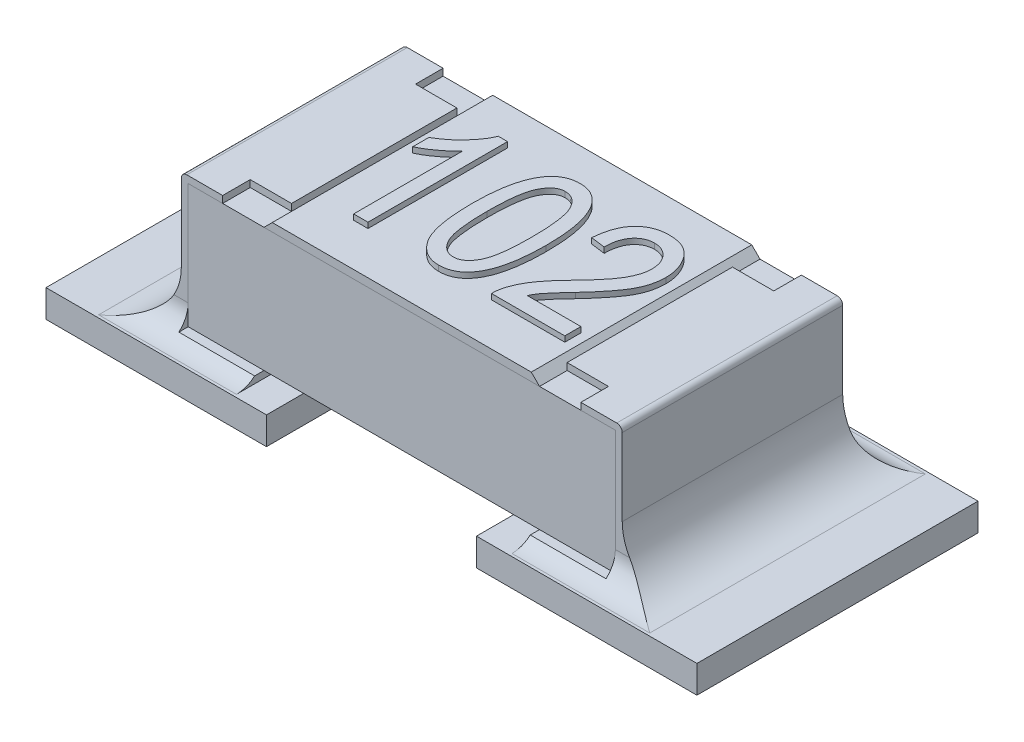
from build123d import *

# Parameters (mm, degrees)
SKETCH1_W             = 0.8
SKETCH1_H             = 0.45
BOSS_EXTRUDE1_DEPTH   = 0.775
BOSS_EXTRUDE2_DEPTH   = 0.4
BOSS_EXTRUDE2_2_DEPTH = 0.4
SKETCH3_W             = 0.15
SKETCH3_H             = 0.1
CUT_EXTRUDE1_DEPTH    = 0.025
BOSS_EXTRUDE3_DEPTH   = 0.4
SKETCH7_W             = 0.8
SKETCH7_H             = 1.02
BOSS_EXTRUDE5_DEPTH   = 0.1
FILLET3_R             = 0.2
FILLET4_R             = 0.2
FILLET5_R             = 0.1
FILLET6_R             = 0.1
BOSS_EXTRU_1_DEPTH    = 0.02


with BuildPart() as part:
    # Sketch1 → Boss-Extrude1 (new, symmetric)
    with BuildSketch(Plane(origin=(0, 0, 0), x_dir=(0, 0, -1), z_dir=(1, 0, 0))):
        with Locations((0, 0.35)):
            Rectangle(SKETCH1_W, SKETCH1_H)
    extrude(amount=BOSS_EXTRUDE1_DEPTH, both=True)


with BuildPart() as body_2:
    # Sketch2 → Boss-Extrude2 (new, symmetric)
    with BuildSketch(Plane.XY):
        with BuildLine():
            Line((-0.5, 0.6), (-0.78, 0.6))
            ThreePointArc((-0.78, 0.6), (-0.794142136, 0.594142136), (-0.8, 0.58))
            Line((-0.8, 0.58), (-0.8, 0.1))
            Line((-0.8, 0.1), (-0.5, 0.1))
            Line((-0.5, 0.1), (-0.5, 0.125))
            Line((-0.5, 0.125), (-0.775, 0.125))
            Line((-0.775, 0.125), (-0.775, 0.575))
            Line((-0.775, 0.575), (-0.5, 0.575))
            Line((-0.5, 0.575), (-0.5, 0.6))
        make_face()
    extrude(amount=BOSS_EXTRUDE2_DEPTH, both=True)


with BuildPart() as body_3:
    # Sketch2 → Boss-Extrude2 2 (new, symmetric)
    with BuildSketch(Plane.XY):
        with BuildLine():
            Line((0.5, 0.575), (0.5, 0.6))
            Line((0.5, 0.6), (0.78, 0.6))
            ThreePointArc((0.78, 0.6), (0.794142136, 0.594142136), (0.8, 0.58))
            Line((0.8, 0.58), (0.8, 0.1))
            Line((0.8, 0.1), (0.5, 0.1))
            Line((0.5, 0.1), (0.5, 0.125))
            Line((0.5, 0.125), (0.775, 0.125))
            Line((0.775, 0.125), (0.775, 0.575))
            Line((0.775, 0.575), (0.5, 0.575))
        make_face()
    extrude(amount=BOSS_EXTRUDE2_2_DEPTH, both=True)


with BuildPart() as cut_extrude1_tool:
    # Sketch3 → Cut-Extrude1 (new body)
    with BuildSketch(Plane(origin=(0, 0.6, 0), x_dir=(1, 0, 0), z_dir=(0, 1, 0))):
        with Locations((-0.575, 0.35)):
            Rectangle(SKETCH3_W, SKETCH3_H)
        with Locations((-0.575, -0.35)):
            Rectangle(SKETCH3_W, SKETCH3_H)
        with Locations((0.575, -0.35)):
            Rectangle(SKETCH3_W, SKETCH3_H)
        with Locations((0.575, 0.35)):
            Rectangle(SKETCH3_W, SKETCH3_H)
    extrude(amount=-CUT_EXTRUDE1_DEPTH)


with BuildPart() as body_2_1:
    add(body_2.part)

    # Cut-Extrude1: cut by cut_extrude1_tool
    add(cut_extrude1_tool.part, mode=Mode.SUBTRACT)



with BuildPart() as body_3_1:
    add(body_3.part)

    # Cut-Extrude1: cut by cut_extrude1_tool
    add(cut_extrude1_tool.part, mode=Mode.SUBTRACT)


with BuildPart() as body_4:
    # Sketch4 → Boss-Extrude3 (new, symmetric)
    with BuildSketch(Plane.XY):
        Polygon((-0.5, 0.575), (0.5, 0.575), (0.47, 0.605), (-0.47, 0.605), align=None)
    extrude(amount=BOSS_EXTRUDE3_DEPTH, both=True)

    # Esquisse2 → Boss.-Extru.1 (add)
    # profile 1 of 3: a face of its own
    with BuildSketch(Plane(origin=(0, 0.605, 0), x_dir=(1, 0, 0), z_dir=(0, 1, 0))):
        with BuildLine():
            Line((-0.277419159, -0.245221888), (-0.329367211, -0.245221888))
            Line((-0.329367211, -0.245221888), (-0.329367211, 0.150882009))
            add(Edge.make_bspline(
                [(-0.329367211, 0.150882009), (-0.33255753, 0.147209677), (-0.339169464, 0.139598774), (-0.350647442, 0.128775009), (-0.363438381, 0.1176135), (-0.377599648, 0.106782892), (-0.392028853, 0.096408923), (-0.406280373, 0.087284837), (-0.41982007, 0.079346193), (-0.428903295, 0.075031174), (-0.433263315, 0.072959931)],
                knots=[0, 0, 0, 0, 0.892555828, 1.849821039, 2.893015883, 4.008277588, 5.121255548, 6.154629642, 7.114207698, 8, 8, 8, 8], degree=3))
            Line((-0.433263315, 0.072959931), (-0.433263315, 0.131401489))
            add(Edge.make_bspline(
                [(-0.433263315, 0.131401489), (-0.426256411, 0.13561851), (-0.412302603, 0.144016443), (-0.392751491, 0.158564375), (-0.374281809, 0.174266475), (-0.35744561, 0.191287267), (-0.342370643, 0.208833156), (-0.329431452, 0.226343975), (-0.318822135, 0.243633673), (-0.313617925, 0.255526991), (-0.311104224, 0.261271619)],
                knots=[0, 0, 0, 0, 1.082272232, 2.155277244, 3.222407096, 4.289527553, 5.32168536, 6.282742408, 7.170542132, 8, 8, 8, 8], degree=3))
            Line((-0.311104224, 0.261271619), (-0.277419159, 0.261271619))
            Line((-0.277419159, 0.261271619), (-0.277419159, -0.245221888))
        make_face()
    # profile 2 of 3: a face of its own
    with BuildSketch(Plane(origin=(0, 0.605, 0), x_dir=(1, 0, 0), z_dir=(0, 1, 0))):
        with BuildLine():
            add(Edge.make_bspline(
                [(-0.147549029, 0.00457519), (-0.147466537, 0.01479126), (-0.147306358, 0.034628409), (-0.145650941, 0.063399949), (-0.143039858, 0.090278959), (-0.139489137, 0.115229398), (-0.134683655, 0.138255011), (-0.12902472, 0.15939274), (-0.122074419, 0.178575365), (-0.114251427, 0.195885139), (-0.105280253, 0.21122541), (-0.095389914, 0.224648892), (-0.084287025, 0.235937722), (-0.072277736, 0.245324824), (-0.059123137, 0.252476152), (-0.04501046, 0.257615666), (-0.029887534, 0.260717058), (-0.019452187, 0.261084261), (-0.014127763, 0.261271619)],
                knots=[0, 0, 0, 0, 1.522295809, 2.955932353, 4.292935845, 5.545987552, 6.709403679, 7.796379217, 8.803980711, 9.746667296, 10.623167879, 11.447716403, 12.224665142, 12.975696349, 13.710987297, 14.4460191, 15.207112772, 16, 16, 16, 16], degree=3))
            add(Edge.make_bspline(
                [(-0.014127763, 0.261271619), (-0.00938285, 0.261119405), (-6.4928e-05, 0.260820492), (0.013532278, 0.258355488), (0.026321328, 0.254161939), (0.038311883, 0.248334155), (0.04946752, 0.240809961), (0.059897997, 0.231712272), (0.069489012, 0.22085766), (0.075042737, 0.212703293), (0.0778974, 0.208511879)],
                knots=[0, 0, 0, 0, 1.02435884, 2.0116063, 2.972586715, 3.92329494, 4.881606269, 5.870473939, 6.905405214, 8, 8, 8, 8], degree=3))
            add(Edge.make_bspline(
                [(0.0778974, 0.208511879), (0.081201753, 0.202860902), (0.088073505, 0.191109101), (0.09627871, 0.171419216), (0.103194942, 0.149427268), (0.109026426, 0.125063264), (0.113186158, 0.098276968), (0.116478331, 0.069172575), (0.118383679, 0.037676929), (0.118581978, 0.015873733), (0.118684737, 0.00457519)],
                knots=[0, 0, 0, 0, 0.745747152, 1.550859881, 2.42529298, 3.372802996, 4.404287875, 5.514077945, 6.711780846, 8, 8, 8, 8], degree=3))
            add(Edge.make_bspline(
                [(0.118684737, 0.00457519), (0.118603246, -0.005573368), (0.118445039, -0.025275587), (0.116773055, -0.053910105), (0.114196761, -0.080658499), (0.110597814, -0.10553284), (0.105836898, -0.128501924), (0.100102772, -0.149633905), (0.093369381, -0.168919426), (0.085438101, -0.186231046), (0.076598991, -0.201660817), (0.066540873, -0.214948272), (0.055705564, -0.226438872), (0.043540388, -0.23562265), (0.030475546, -0.242976397), (0.016267757, -0.248029288), (0.001094421, -0.251174149), (-0.009377101, -0.25153216), (-0.014736529, -0.251715394)],
                knots=[0, 0, 0, 0, 1.513874866, 2.939007974, 4.277477108, 5.521918538, 6.686610019, 7.774777114, 8.786532326, 9.730252297, 10.61206932, 11.433487149, 12.211385775, 12.960169701, 13.698700869, 14.439280195, 15.201208188, 16, 16, 16, 16], degree=3))
            add(Edge.make_bspline(
                [(-0.014736529, -0.251715394), (-0.019516724, -0.251535975), (-0.028915126, -0.251183218), (-0.042705055, -0.248501144), (-0.05575647, -0.243876751), (-0.068138313, -0.237523555), (-0.079867046, -0.229401051), (-0.090799365, -0.219338145), (-0.101199397, -0.207599728), (-0.110942062, -0.19396939), (-0.119746041, -0.178096762), (-0.127188231, -0.159604049), (-0.133528749, -0.138579583), (-0.138560256, -0.114938484), (-0.142795274, -0.08877738), (-0.145456819, -0.059965056), (-0.147220924, -0.028557109), (-0.147436804, -0.006757381), (-0.147549029, 0.00457519)],
                knots=[0, 0, 0, 0, 0.713782411, 1.403376538, 2.088831486, 2.775699897, 3.476400496, 4.213162367, 4.989742879, 5.815463779, 6.710980744, 7.6941898, 8.787315853, 9.987366569, 11.302150399, 12.743876293, 14.307306722, 16, 16, 16, 16], degree=3))
        make_face()
        with BuildLine():
            add(Edge.make_bspline(
                [(-0.095600977, 0.004778112), (-0.095510395, -0.004962844), (-0.095337358, -0.023570963), (-0.094386416, -0.050273881), (-0.092589043, -0.074440086), (-0.090092676, -0.096145725), (-0.086927693, -0.115301137), (-0.083021376, -0.132011786), (-0.078366616, -0.146209724), (-0.072890289, -0.158097103), (-0.066817423, -0.167965156), (-0.060330818, -0.176373903), (-0.053623871, -0.183666527), (-0.046292266, -0.189491854), (-0.038680682, -0.194202042), (-0.030494994, -0.19727545), (-0.022023943, -0.199493814), (-0.016171753, -0.199675523), (-0.013214613, -0.199767342)],
                knots=[0, 0, 0, 0, 1.930873368, 3.688541263, 5.295281011, 6.732986767, 8.018032389, 9.141589856, 10.131594649, 10.974379403, 11.729767228, 12.422984227, 13.077418253, 13.687793181, 14.274134012, 14.843047171, 15.415386244, 16, 16, 16, 16], degree=3))
            add(Edge.make_bspline(
                [(-0.013214613, -0.199767342), (-0.010427064, -0.19967107), (-0.004876608, -0.199479377), (0.003214206, -0.197283662), (0.011014124, -0.194062792), (0.018392056, -0.189401372), (0.025337409, -0.183405877), (0.031944313, -0.176126804), (0.038222607, -0.167556151), (0.044243115, -0.157540122), (0.049661257, -0.145592351), (0.054269802, -0.131326946), (0.058147641, -0.114621658), (0.061355308, -0.095476215), (0.063679163, -0.073856395), (0.065539644, -0.049836144), (0.066465897, -0.023333722), (0.066643834, -0.004861208), (0.066736685, 0.004778112)],
                knots=[0, 0, 0, 0, 0.556098029, 1.107279675, 1.665020537, 2.239289732, 2.843790749, 3.494855459, 4.20099618, 4.965402842, 5.827994078, 6.818278647, 7.958442113, 9.254955883, 10.697998423, 12.305588537, 14.072183745, 16, 16, 16, 16], degree=3))
            add(Edge.make_bspline(
                [(0.066736685, 0.004778112), (0.066644247, 0.014518953), (0.066467022, 0.033194439), (0.065536544, 0.059932684), (0.063706558, 0.084163121), (0.061254358, 0.105841815), (0.058028708, 0.125018143), (0.054199757, 0.141717126), (0.049468888, 0.155886496), (0.044070333, 0.167750164), (0.037873861, 0.177530431), (0.031547138, 0.186066808), (0.024613966, 0.193179002), (0.017326453, 0.199101273), (0.009578464, 0.203716122), (0.001336, 0.207013805), (-0.007336855, 0.208998194), (-0.013272092, 0.209214654), (-0.016258444, 0.209323567)],
                knots=[0, 0, 0, 0, 1.926173374, 3.692928135, 5.28908838, 6.72993665, 8.005261178, 9.132588719, 10.113846285, 10.954579593, 11.702439438, 12.399284011, 13.051919516, 13.660808713, 14.251466784, 14.827675714, 15.41013748, 16, 16, 16, 16], degree=3))
            add(Edge.make_bspline(
                [(-0.016258444, 0.209323567), (-0.019046448, 0.209229838), (-0.024564948, 0.209044314), (-0.032588492, 0.206839344), (-0.040285896, 0.203615308), (-0.047609781, 0.198933153), (-0.054467733, 0.192853165), (-0.061128216, 0.185619176), (-0.067268818, 0.176971227), (-0.073311403, 0.16704689), (-0.078634531, 0.155067165), (-0.083250225, 0.140826575), (-0.086962575, 0.124091318), (-0.090243034, 0.105003485), (-0.092537193, 0.083411294), (-0.094405868, 0.059392779), (-0.095329633, 0.03288983), (-0.095507935, 0.014417392), (-0.095600977, 0.004778112)],
                knots=[0, 0, 0, 0, 0.557102101, 1.102712893, 1.655222221, 2.224793741, 2.834805151, 3.487045402, 4.190458401, 4.956245252, 5.811421647, 6.809929224, 7.950602775, 9.242777249, 10.688425301, 12.298918027, 14.068702942, 16, 16, 16, 16], degree=3))
        make_face(mode=Mode.SUBTRACT)
    # profile 3 of 3: a face of its own
    with BuildSketch(Plane(origin=(0, 0.605, 0), x_dir=(1, 0, 0), z_dir=(0, 1, 0))):
        with BuildLine():
            Line((0.436866556, -0.186780329), (0.436866556, -0.245221888))
            Line((0.436866556, -0.245221888), (0.170632789, -0.245221888))
            add(Edge.make_bspline(
                [(0.170632789, -0.245221888), (0.170620463, -0.242176838), (0.170595488, -0.236007517), (0.171425805, -0.226601844), (0.173131761, -0.216968453), (0.175310093, -0.206978835), (0.17839873, -0.196764374), (0.182179794, -0.186275439), (0.186641118, -0.175538143), (0.191864922, -0.164488895), (0.197969199, -0.153021711), (0.205335292, -0.141184566), (0.213800759, -0.128765128), (0.223376797, -0.115839112), (0.234250689, -0.102529104), (0.246099687, -0.088637518), (0.259092893, -0.074193289), (0.268344083, -0.064593521), (0.273108439, -0.059649647)],
                knots=[0, 0, 0, 0, 0.672188691, 1.361865275, 2.08134618, 2.831455259, 3.618325166, 4.435686407, 5.292818481, 6.184803937, 7.133719261, 8.159707436, 9.261705982, 10.452168352, 11.710682541, 13.056179633, 14.483934645, 16, 16, 16, 16], degree=3))
            add(Edge.make_bspline(
                [(0.273108439, -0.059649647), (0.278645154, -0.053922862), (0.28930567, -0.042896383), (0.304309328, -0.026615111), (0.317941658, -0.011481871), (0.329930295, 0.002776991), (0.340488081, 0.015967273), (0.349721239, 0.028070116), (0.357188517, 0.039360185), (0.365251054, 0.052644574), (0.372937537, 0.068459429), (0.379732824, 0.086894144), (0.384123449, 0.104715028), (0.384658645, 0.116463957), (0.384918504, 0.122168535)],
                knots=[0, 0, 0, 0, 1.312560889, 2.527233899, 3.64818266, 4.668586789, 5.596397896, 6.432357998, 7.175835261, 7.825761013, 8.992224112, 10.065918602, 11.060925749, 12, 12, 12, 12], degree=3))
            add(Edge.make_bspline(
                [(0.384918504, 0.122168535), (0.38488227, 0.125317915), (0.384811501, 0.131468985), (0.383608892, 0.140451965), (0.381893813, 0.14899617), (0.3796294, 0.157163351), (0.376418723, 0.164819361), (0.372571791, 0.172017316), (0.368065657, 0.178789817), (0.362923472, 0.185037408), (0.357252813, 0.190673516), (0.351276734, 0.195736851), (0.344839772, 0.199834879), (0.338206488, 0.203402296), (0.33115273, 0.205987741), (0.323827032, 0.207958519), (0.316161618, 0.209069733), (0.310956748, 0.209238117), (0.308315419, 0.209323567)],
                knots=[0, 0, 0, 0, 1.164486654, 2.274364258, 3.346924328, 4.388668322, 5.404300818, 6.412115579, 7.404820287, 8.409522099, 9.400647826, 10.360464378, 11.301161788, 12.219192522, 13.141987859, 14.073903283, 15.022558797, 16, 16, 16, 16], degree=3))
            add(Edge.make_bspline(
                [(0.308315419, 0.209323567), (0.305467549, 0.209263822), (0.299908376, 0.209147197), (0.291805518, 0.207697867), (0.284041492, 0.205758951), (0.276655696, 0.202751859), (0.269702154, 0.198899959), (0.263080695, 0.194263463), (0.256920928, 0.188754733), (0.251098767, 0.182490648), (0.245994902, 0.175347606), (0.241308805, 0.167618053), (0.237618701, 0.158974566), (0.234481048, 0.149683668), (0.232023772, 0.139637057), (0.230381279, 0.128872622), (0.229176758, 0.117392989), (0.229109112, 0.109489326), (0.229074348, 0.105427463)],
                knots=[0, 0, 0, 0, 0.928788257, 1.813037313, 2.680996359, 3.53827917, 4.408273621, 5.272359245, 6.172129225, 7.102295458, 8.058839945, 9.034325244, 10.048074492, 11.120300332, 12.234644845, 13.420320921, 14.674247329, 16, 16, 16, 16], degree=3))
            Line((0.229074348, 0.105427463), (0.177126296, 0.11192097))
            add(Edge.make_bspline(
                [(0.177126296, 0.11192097), (0.177661646, 0.117949128), (0.178700249, 0.129644029), (0.181425255, 0.146574214), (0.185206691, 0.162282392), (0.189695492, 0.176925272), (0.195342921, 0.190321129), (0.201656925, 0.202713751), (0.209140532, 0.213833745), (0.217485989, 0.223818585), (0.226623406, 0.232677174), (0.236501282, 0.24032371), (0.247106206, 0.246769595), (0.258317066, 0.252189545), (0.270365598, 0.256236922), (0.283035651, 0.259174418), (0.296430274, 0.260914731), (0.305570867, 0.261150899), (0.310243179, 0.261271619)],
                knots=[0, 0, 0, 0, 1.296155121, 2.514599762, 3.669097984, 4.755193195, 5.79120272, 6.77953026, 7.729955905, 8.65570694, 9.562583864, 10.450894749, 11.325630111, 12.216772649, 13.112585423, 14.04224033, 14.999270054, 16, 16, 16, 16], degree=3))
            add(Edge.make_bspline(
                [(0.310243179, 0.261271619), (0.315287924, 0.261123536), (0.325110881, 0.260835194), (0.339410791, 0.258935248), (0.352748071, 0.255583871), (0.365182294, 0.250920378), (0.376564128, 0.244781019), (0.387078711, 0.237416689), (0.396550564, 0.228603521), (0.404979649, 0.21857538), (0.412428841, 0.207748797), (0.418928747, 0.196427916), (0.424566895, 0.18480032), (0.428973266, 0.172736626), (0.432653055, 0.16039874), (0.434964779, 0.147599635), (0.436592216, 0.134486989), (0.436774592, 0.125623379), (0.436866556, 0.121153924)],
                knots=[0, 0, 0, 0, 1.141256367, 2.222215694, 3.255808886, 4.246221905, 5.218350639, 6.173592628, 7.142736081, 8.136099926, 9.131465336, 10.11177911, 11.087094076, 12.050634184, 13.014356534, 13.995714735, 14.989343724, 16, 16, 16, 16], degree=3))
            add(Edge.make_bspline(
                [(0.436866556, 0.121153924), (0.436779909, 0.117127141), (0.436607744, 0.109126037), (0.4354878, 0.097187936), (0.43351089, 0.085410333), (0.43094396, 0.073679984), (0.427301469, 0.062178516), (0.423177974, 0.050723257), (0.418176495, 0.039443439), (0.412272125, 0.028118881), (0.405358874, 0.016348836), (0.397074513, 0.003918486), (0.387572676, -0.009504436), (0.376467413, -0.023680764), (0.364296829, -0.039018169), (0.350523248, -0.055130192), (0.335415402, -0.072158915), (0.324771484, -0.083713449), (0.319273211, -0.089682115)],
                knots=[0, 0, 0, 0, 0.78053567, 1.550902233, 2.321464013, 3.094364546, 3.87611052, 4.657966429, 5.453363508, 6.265521698, 7.132350641, 8.097801917, 9.160103787, 10.319208993, 11.587678713, 12.955014444, 14.427067756, 16, 16, 16, 16], degree=3))
            add(Edge.make_bspline(
                [(0.319273211, -0.089682115), (0.31578272, -0.093395828), (0.30911211, -0.100493032), (0.299665728, -0.110762774), (0.291188926, -0.120105032), (0.28349715, -0.128388282), (0.276970664, -0.135891091), (0.271312279, -0.142415262), (0.266688943, -0.148041211), (0.259760015, -0.156885556), (0.251020841, -0.169347157), (0.244983139, -0.181095194), (0.242061361, -0.186780329)],
                knots=[0, 0, 0, 0, 1.227496676, 2.345844757, 3.360613726, 4.265798447, 5.068085109, 5.75545707, 6.345771879, 6.821573405, 8.46188917, 10, 10, 10, 10], degree=3))
            Line((0.242061361, -0.186780329), (0.436866556, -0.186780329))
        make_face()
    extrude(amount=BOSS_EXTRU_1_DEPTH)


with BuildPart() as body_2_2:
    add(body_2_1.part)

    add(body_3_1.part)  # Boss-Extrude5 merges body 3
    # Sketch7 → Boss-Extrude5 (add)
    with BuildSketch(Plane(origin=(0, 0, 0), x_dir=(1, 0, 0), z_dir=(0, 1, 0))):
        with Locations((-0.781, 0)):
            Rectangle(SKETCH7_W, SKETCH7_H)
        with Locations((0.781, 0)):
            Rectangle(SKETCH7_W, SKETCH7_H)
    extrude(amount=BOSS_EXTRUDE5_DEPTH)

    # Fillet3
    fillet3_edges = [body_2_2.edges().sort_by_distance(p)[0] for p in [
        (-0.8, 0.1, 0),
    ]]
    fillet(fillet3_edges, radius=FILLET3_R)

    # Fillet4
    fillet4_edges = [body_2_2.edges().sort_by_distance(p)[0] for p in [
        (0.8, 0.1, 0),
    ]]
    fillet(fillet4_edges, radius=FILLET4_R)

    # Fillet5
    fillet5_edges = [body_2_2.edges().sort_by_distance(p)[0] for p in [
        (0.75, 0.1, 0.4),
    ]]
    fillet(fillet5_edges, radius=FILLET5_R)
    fillet5_2_edges = [body_2_2.edges().sort_by_distance(p)[0] for p in [
        (0.75, 0.1, -0.4),
    ]]
    fillet(fillet5_2_edges, radius=FILLET5_R)

    # Fillet6
    fillet6_edges = [body_2_2.edges().sort_by_distance(p)[0] for p in [
        (-0.75, 0.1, -0.4),
    ]]
    fillet(fillet6_edges, radius=FILLET6_R)
    fillet6_2_edges = [body_2_2.edges().sort_by_distance(p)[0] for p in [
        (-0.75, 0.1, 0.4),
    ]]
    fillet(fillet6_2_edges, radius=FILLET6_R)


solid = Compound([part.part, body_4.part, body_2_2.part])
